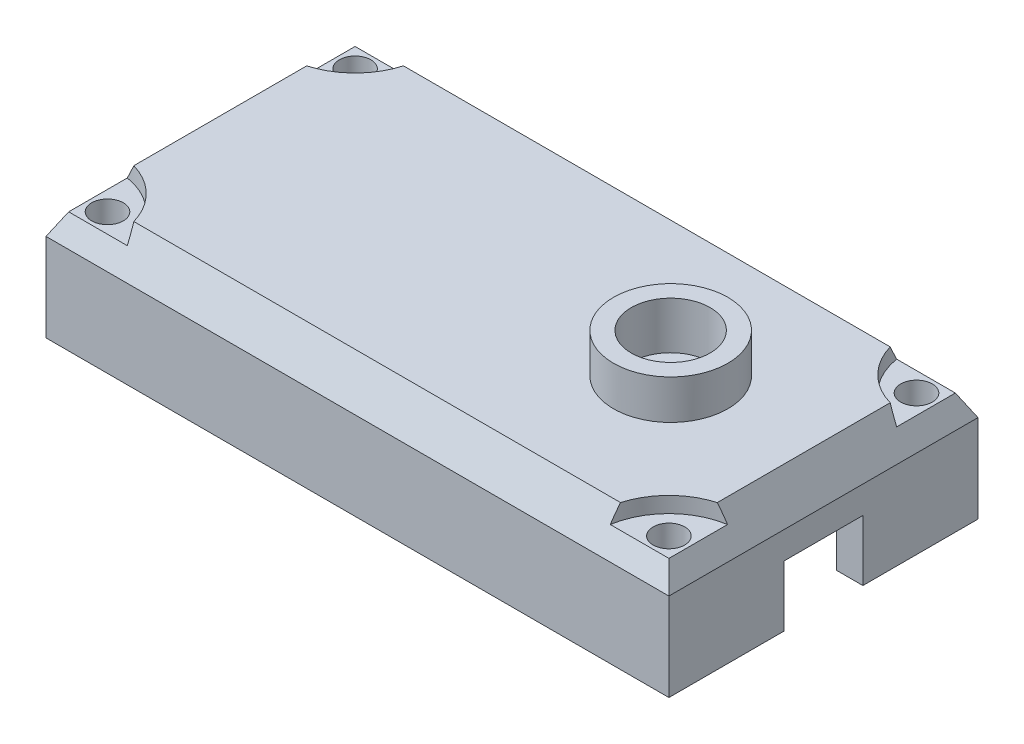
from build123d import *

# Parameters (mm, degrees)
SKETCH1_W           = 40.132
SKETCH1_H           = 19.9136
BOSS_EXTRUDE1_DEPTH = 8.7122
SHELL1_T            = -1.7145
SKETCH3_R           = 3.683
BOSS_EXTRUDE2_DEPTH = 2.54
SKETCH4_R           = 2.54
CUT_EXTRUDE2_DEPTH  = 3.048
SKETCH8_R           = 1.778
BOSS_EXTRUDE5_DEPTH = 6.9977
SKETCH7_R           = 1.016
CUT_EXTRUDE5_DEPTH  = 8.7122
CHAMFER1_SIZE       = 2.3876
CHAMFER1_SIZE_2     = 1.27
SKETCH2_R           = 4.567425491
CUT_EXTRUDE6_DEPTH  = 1.016
SKETCH10_W          = 40.259
SKETCH10_H          = 19.9136
CUT_EXTRUDE7_DEPTH  = 0.6604
SKETCH11_W          = 5.08
SKETCH11_H          = 4.572
CUT_EXTRUDE8_DEPTH  = 1.7145
SKETCH12_R          = 8.5725
CUT_EXTRUDE9_DEPTH  = 6.9977


with BuildPart() as part:
    # Sketch1 → Boss-Extrude1 (new body)
    with BuildSketch(Plane(origin=(0, 0, 0), x_dir=(1, 0, 0), z_dir=(0, 1, 0))):
        Rectangle(SKETCH1_W, SKETCH1_H)
    extrude(amount=BOSS_EXTRUDE1_DEPTH)

    # Shell1
    shell1_openings = [part.faces().sort_by_distance(p)[0] for p in [
        (0, 0, 0),
    ]]
    offset(amount=SHELL1_T, openings=shell1_openings, kind=Kind.INTERSECTION)

    # Sketch3 → Boss-Extrude2 (add)
    with BuildSketch(Plane(origin=(0, 8.7122, 0), x_dir=(1, 0, 0), z_dir=(0, 1, 0))):
        with Locations(Location((10.2235, 0, 0), (0, 0, 90))):
            Circle(SKETCH3_R)
    extrude(amount=BOSS_EXTRUDE2_DEPTH)

    # Sketch4 → Cut-Extrude2 (cut)
    with BuildSketch(Plane(origin=(0, 11.2522, 0), x_dir=(1, 0, 0), z_dir=(0, 1, 0))):
        with Locations(Location((10.2235, 0, 0), (0, 0, 270))):
            Circle(SKETCH4_R)
    extrude(amount=-CUT_EXTRUDE2_DEPTH, mode=Mode.SUBTRACT)

    # Sketch8 → Boss-Extrude5 (add)
    with BuildSketch(Plane(origin=(0, 0, 0), x_dir=(-1, 0, 0), z_dir=(0, -1, 0))):
        with Locations((18.288, 8.1788)):
            Circle(SKETCH8_R)
        with Locations((-18.288, 8.1788)):
            Circle(SKETCH8_R)
        with Locations((18.288, -8.1788)):
            Circle(SKETCH8_R)
        with Locations((-18.288, -8.1788)):
            Circle(SKETCH8_R)
    extrude(amount=-BOSS_EXTRUDE5_DEPTH)

    # Sketch7 → Cut-Extrude5 (cut)
    with BuildSketch(Plane(origin=(0, 0, 0), x_dir=(-1, 0, 0), z_dir=(0, -1, 0))):
        with Locations(Location((18.0848, 7.9756, 0), (0, 0, 90))):
            Circle(SKETCH7_R)
        with Locations(Location((-18.0848, 7.9756, 0), (0, 0, 90))):
            Circle(SKETCH7_R)
        with Locations(Location((18.0848, -7.9756, 0), (0, 0, 90))):
            Circle(SKETCH7_R)
        with Locations(Location((-18.0848, -7.9756, 0), (0, 0, 90))):
            Circle(SKETCH7_R)
    extrude(amount=-CUT_EXTRUDE5_DEPTH, mode=Mode.SUBTRACT)

    # Chamfer1
    # the kernel refuses this chamfer: 2.3876, 1.27 mm, written as the material it takes off along each edge
    with BuildSketch(Plane(origin=(20.066, 8.7122, 16.137611711), x_dir=(0.018140787758026848, -0.9998354423701522, 0), z_dir=(0, 0, -1))) as chamfer1_piece_1:
        Polygon((CHAMFER1_SIZE * 0.99983544237, CHAMFER1_SIZE * 0.018140787758), (-CHAMFER1_SIZE_2 * 0.018140787758, CHAMFER1_SIZE_2 * 0.99983544237), (0, 0), align=None)
    extrude(amount=32.275223423, mode=Mode.SUBTRACT)
    with BuildSketch(Plane(origin=(26.246811711, 8.7122, -9.9568), x_dir=(0, -0.9998354423701524, -0.01814078775802685), z_dir=(-1, 0, 0))) as chamfer1_piece_2:
        Polygon((CHAMFER1_SIZE * 0.99983544237, CHAMFER1_SIZE * 0.018140787758), (-CHAMFER1_SIZE_2 * 0.018140787758, CHAMFER1_SIZE_2 * 0.99983544237), (0, 0), align=None)
    extrude(amount=52.493623423, mode=Mode.SUBTRACT)
    with BuildSketch(Plane(origin=(-20.066, 8.7122, -16.137611711), x_dir=(0.9979501613334688, 0.06399590216962081, 0), z_dir=(0, 0, 1))) as chamfer1_piece_3:
        Polygon((CHAMFER1_SIZE_2 * 0.997950161333, -CHAMFER1_SIZE_2 * 0.0639959021696), (-CHAMFER1_SIZE * 0.0639959021696, -CHAMFER1_SIZE * 0.997950161333), (0, 0), align=None)
    extrude(amount=32.275223423, mode=Mode.SUBTRACT)
    with BuildSketch(Plane(origin=(-26.246811711, 8.7122, 9.9568), x_dir=(0, 0.06399590216962081, -0.9979501613334687), z_dir=(1, 0, 0))) as chamfer1_piece_4:
        Polygon((CHAMFER1_SIZE_2 * 0.997950161333, -CHAMFER1_SIZE_2 * 0.0639959021696), (-CHAMFER1_SIZE * 0.0639959021696, -CHAMFER1_SIZE * 0.997950161333), (0, 0), align=None)
    extrude(amount=52.493623423, mode=Mode.SUBTRACT)

    # Sketch2 → Cut-Extrude6 (cut)
    with BuildSketch(Plane(origin=(0, 8.7122, 0), x_dir=(1, 0, 0), z_dir=(0, 1, 0))):
        with Locations((20.066, 9.9568)):
            Circle(SKETCH2_R)
        with Locations((-20.066, 9.9568)):
            Circle(SKETCH2_R)
        with Locations((-20.066, -9.9568)):
            Circle(SKETCH2_R)
        with Locations((20.066, -9.9568)):
            Circle(SKETCH2_R)
    extrude(amount=-CUT_EXTRUDE6_DEPTH, mode=Mode.SUBTRACT)

    # Sketch10 → Cut-Extrude7 (cut)
    with BuildSketch(Plane(origin=(0, 0, 0), x_dir=(-1, 0, 0), z_dir=(0, -1, 0))):
        with Locations((0.0635, 0)):
            Rectangle(SKETCH10_W, SKETCH10_H)
    extrude(amount=-CUT_EXTRUDE7_DEPTH, mode=Mode.SUBTRACT)

    # Sketch11 → Cut-Extrude8 (cut)
    with BuildSketch(Plane(origin=(20.066, 0, 0), x_dir=(0, 0, -1), z_dir=(1, 0, 0))):
        with Locations((0, 2.286)):
            Rectangle(SKETCH11_W, SKETCH11_H)
    extrude(amount=-CUT_EXTRUDE8_DEPTH, mode=Mode.SUBTRACT)

    # Sketch12 → Cut-Extrude9 (cut)
    with BuildSketch(Plane(origin=(0, 0, 0), x_dir=(-1, 0, 0), z_dir=(0, -1, 0))):
        with Locations((10.2997, 0)):
            Circle(SKETCH12_R)
    extrude(amount=-CUT_EXTRUDE9_DEPTH, mode=Mode.SUBTRACT)


solid = part.part
